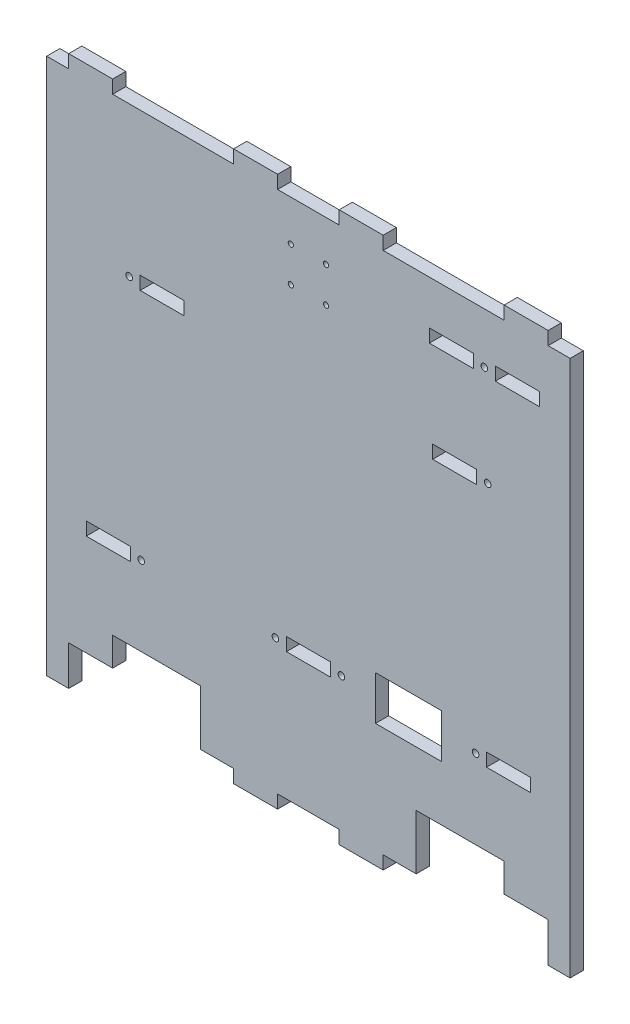
from build123d import *

# Parameters (mm, degrees)
ESQUISSE1_W             = 218
ESQUISSE1_H             = 238
ESQUISSE1_W_2           = 20
ESQUISSE1_H_2           = 6
ESQUISSE1_W_3           = 30
ESQUISSE1_H_3           = 20
BOSS_EXTRU_1_DEPTH      = 6
ESQUISSE2_W             = 40
ESQUISSE2_H             = 25
ENL_V_MAT_EXTRU_1_DEPTH = 6
ESQUISSE3_W             = 20
ESQUISSE3_H             = 6
BOSS_EXTRU_3_DEPTH      = 6
ESQUISSE4_R             = 1.5
ENL_V_MAT_EXTRU_2_DEPTH = 6
ESQUISSE5_W             = 10
ESQUISSE5_H             = 244
BOSS_EXTRU_4_DEPTH      = 6
ESQUISSE6_W             = 20
ESQUISSE6_H             = 12
ENL_V_MAT_EXTRU_3_DEPTH = 6
ESQUISSE7_R             = 1.175
ENL_V_MAT_EXTRU_4_DEPTH = 173.690474549


with BuildPart() as part:
    # Esquisse1 → Boss.-Extru.1 (new body)
    with BuildSketch(Plane.XY):
        Rectangle(ESQUISSE1_W, ESQUISSE1_H)
        with Locations((-91, -58)):
            Rectangle(ESQUISSE1_W_2, ESQUISSE1_H_2, mode=Mode.SUBTRACT)
        with Locations((0, -58)):
            Rectangle(ESQUISSE1_W_2, ESQUISSE1_H_2, mode=Mode.SUBTRACT)
        with Locations((91, -58)):
            Rectangle(ESQUISSE1_W_2, ESQUISSE1_H_2, mode=Mode.SUBTRACT)
        with Locations((-66.5, 51)):
            Rectangle(ESQUISSE1_W_2, ESQUISSE1_H_2, mode=Mode.SUBTRACT)
        with Locations((66.5, 51)):
            Rectangle(ESQUISSE1_W_2, ESQUISSE1_H_2, mode=Mode.SUBTRACT)
        with Locations((45.5, -59)):
            Rectangle(ESQUISSE1_W_3, ESQUISSE1_H_3, mode=Mode.SUBTRACT)
        with Locations((65, 96)):
            Rectangle(ESQUISSE1_W_2, ESQUISSE1_H_2, mode=Mode.SUBTRACT)
        with Locations((95, 96)):
            Rectangle(ESQUISSE1_W_2, ESQUISSE1_H_2, mode=Mode.SUBTRACT)
    extrude(amount=BOSS_EXTRU_1_DEPTH)

    # Esquisse2 → Enlèv. mat.-Extru.1 (cut)
    with BuildSketch(Plane.XY.offset(6)):
        with Locations((-69, -106.5)):
            Rectangle(ESQUISSE2_W, ESQUISSE2_H)
        with Locations((69, -106.5)):
            Rectangle(ESQUISSE2_W, ESQUISSE2_H)
    extrude(amount=-ENL_V_MAT_EXTRU_1_DEPTH, mode=Mode.SUBTRACT)

    # Esquisse3 → Boss.-Extru.3 (add)
    with BuildSketch(Plane.XY.offset(6)):
        with Locations((-24, -122)):
            Rectangle(ESQUISSE3_W, ESQUISSE3_H)
        with Locations((24, -122)):
            Rectangle(ESQUISSE3_W, ESQUISSE3_H)
        with Locations((24, 122)):
            Rectangle(ESQUISSE3_W, ESQUISSE3_H)
        with Locations((99, 122)):
            Rectangle(ESQUISSE3_W, ESQUISSE3_H)
        with Locations((-24, 122)):
            Rectangle(ESQUISSE3_W, ESQUISSE3_H)
        with Locations((-99, 122)):
            Rectangle(ESQUISSE3_W, ESQUISSE3_H)
    extrude(amount=-BOSS_EXTRU_3_DEPTH)

    # Esquisse4 → Enlèv. mat.-Extru.2 (cut)
    with BuildSketch(Plane.XY.offset(6)):
        with Locations((-15, -58)):
            Circle(ESQUISSE4_R)
        with Locations((-76, -58)):
            Circle(ESQUISSE4_R)
        with Locations((80, 96)):
            Circle(ESQUISSE4_R)
        with Locations((81.5, 51)):
            Circle(ESQUISSE4_R)
        with Locations((76, -58)):
            Circle(ESQUISSE4_R)
        with Locations((15, -58)):
            Circle(ESQUISSE4_R)
        with Locations((-81.5, 51)):
            Circle(ESQUISSE4_R)
    extrude(amount=-ENL_V_MAT_EXTRU_2_DEPTH, mode=Mode.SUBTRACT)

    # Esquisse5 → Boss.-Extru.4 (add)
    with BuildSketch(Plane.XY.offset(6)):
        with Locations((-114, -3)):
            Rectangle(ESQUISSE5_W, ESQUISSE5_H)
        with Locations((114, -3)):
            Rectangle(ESQUISSE5_W, ESQUISSE5_H)
    extrude(amount=-BOSS_EXTRU_4_DEPTH)

    # Esquisse6 → Enlèv. mat.-Extru.3 (cut)
    with BuildSketch(Plane.XY.offset(6)):
        with Locations((99, -113)):
            Rectangle(ESQUISSE6_W, ESQUISSE6_H)
        with Locations((-99, -113)):
            Rectangle(ESQUISSE6_W, ESQUISSE6_H)
    extrude(amount=-ENL_V_MAT_EXTRU_3_DEPTH, mode=Mode.SUBTRACT)

    # Esquisse7 → Enlèv. mat.-Extru.4 (cut, through all)
    with BuildSketch(Plane.XY.offset(6)):
        with Locations((-8, 100.5)):
            Circle(ESQUISSE7_R)
        with Locations((8, 100.5)):
            Circle(ESQUISSE7_R)
        with Locations((-8, 84.5)):
            Circle(ESQUISSE7_R)
        with Locations((8, 84.5)):
            Circle(ESQUISSE7_R)
    extrude(amount=-ENL_V_MAT_EXTRU_4_DEPTH, mode=Mode.SUBTRACT)


solid = part.part
